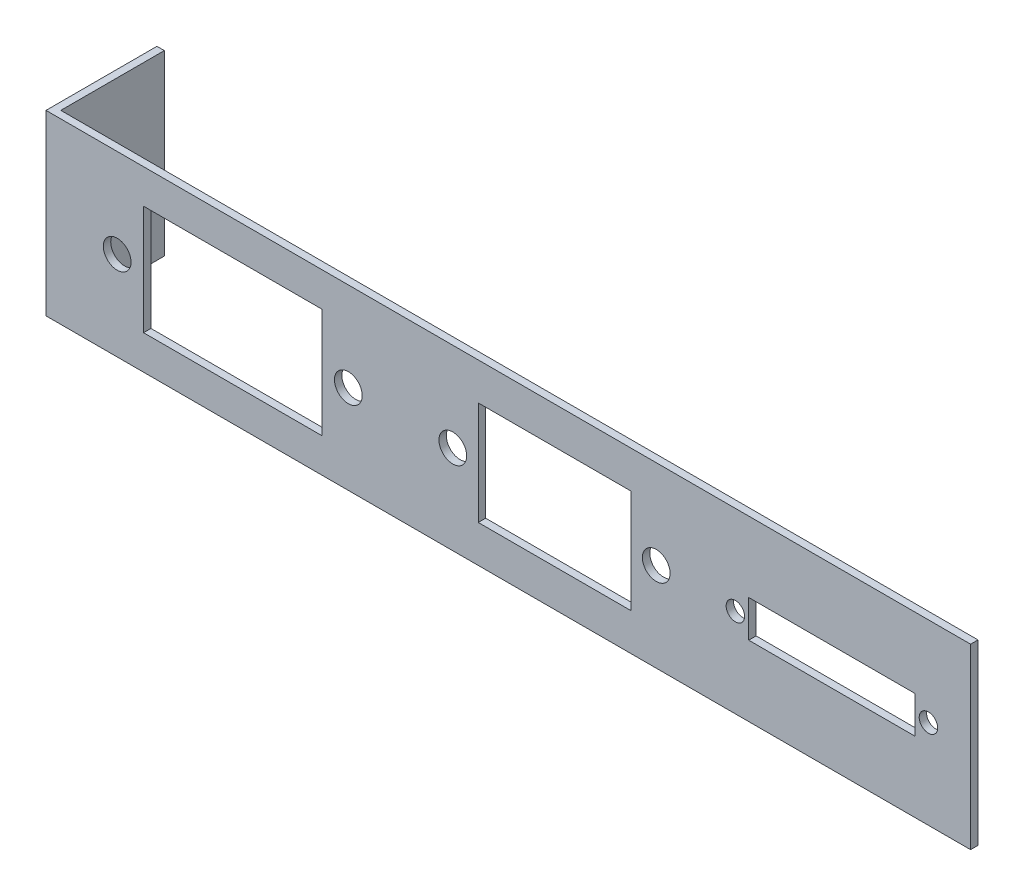
from build123d import *

# Parameters (mm, degrees)
SKETCH1_W               = 100
SKETCH1_H               = 19.25
BOSS_EXTRUDE1_DEPTH     = 0.8
SKETCH2_W               = 0.8
SKETCH2_H               = 19.25
BOSS_EXTRUDE2_DEPTH     = 12
SKETCH3_R               = 1.5
SKETCH3_W               = 19.3
SKETCH3_H               = 11.85
XT60_CUTOUT_DEPTH       = 53.312910691
CUT_EXTRUDE4_DEPTH      = 53.312910691
CUT_EXTRUDE4_DEPTH_BACK = 53.312910691
SKETCH5_R               = 1.5
SKETCH5_W               = 16.5
SKETCH5_H               = 11.2
SKETCH6_R               = 1
SKETCH6_W               = 18
SKETCH6_H               = 4
CUT_EXTRUDE5_DEPTH      = 53.312910691


with BuildPart() as part:
    # Sketch1 → Boss-Extrude1 (new body)
    with BuildSketch(Plane.XY):
        Rectangle(SKETCH1_W, SKETCH1_H)
    extrude(amount=BOSS_EXTRUDE1_DEPTH)

    # Sketch2 → Boss-Extrude2 (add)
    with BuildSketch(Plane(origin=(0, 0, 0.8), x_dir=(-1, 0, 0), z_dir=(0, 0, -1))):
        with Locations((49.6, 0)):
            Rectangle(SKETCH2_W, SKETCH2_H)
    extrude(amount=BOSS_EXTRUDE2_DEPTH)

    # Sketch3 → XT60 cutout (cut, through all)
    with BuildSketch(Plane.XY.offset(0.8)):
        with Locations((-42.3, 0)):
            Circle(SKETCH3_R)
        with Locations((-17.3, 0)):
            Circle(SKETCH3_R)
        with Locations((-29.8, 0)):
            Rectangle(SKETCH3_W, SKETCH3_H)
    extrude(amount=-XT60_CUTOUT_DEPTH, mode=Mode.SUBTRACT)

    # Sketch5 → Cut-Extrude4 (cut, two sides: drawn at the far end of the back side and taken through both)
    with BuildSketch(Plane.XY.offset(0.8).offset(-CUT_EXTRUDE4_DEPTH_BACK)):
        with Locations((-6, 0)):
            Circle(SKETCH5_R)
        with Locations((16, 0)):
            Circle(SKETCH5_R)
        with Locations((5, 0)):
            Rectangle(SKETCH5_W, SKETCH5_H)
    extrude(amount=CUT_EXTRUDE4_DEPTH + CUT_EXTRUDE4_DEPTH_BACK, mode=Mode.SUBTRACT)

    # Sketch6 → Cut-Extrude5 (cut, through all)
    with BuildSketch(Plane.XY.offset(0.8)):
        with Locations((45.44, 0)):
            Circle(SKETCH6_R)
        with Locations((24.56, 0)):
            Circle(SKETCH6_R)
        with Locations((35, 0)):
            Rectangle(SKETCH6_W, SKETCH6_H)
    extrude(amount=-CUT_EXTRUDE5_DEPTH, mode=Mode.SUBTRACT)


solid = part.part
